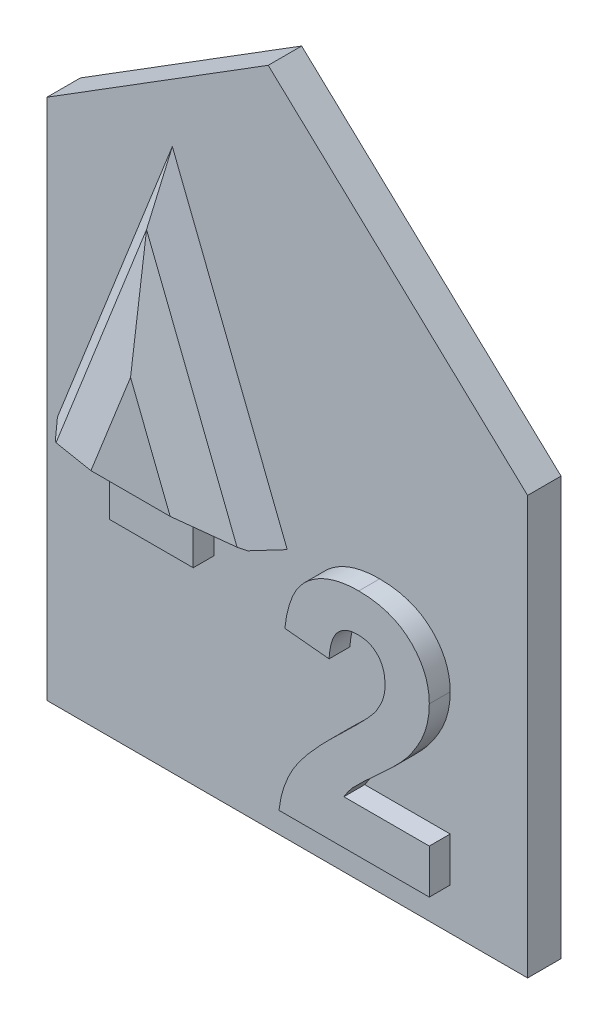
from build123d import *
from OCP.BRepFilletAPI import BRepFilletAPI_MakeChamfer

# Parameters (mm, degrees)
P_IDAT_VYSUNUT_M5_DEPTH = 1.6
P_IDAT_VYSUNUT_M6_DEPTH = 2
SKICA2_7_W              = 2
SKICA2_7_H              = 2
P_IDAT_VYSUNUT_M7_DEPTH = 1
P_IDAT_VYSUNUT_M8_DEPTH = 1
ZKOSEN_5_SIZE2          = 1.678199262
ZKOSEN_5_SIZE           = 2
ZKOSEN_8_SIZE2          = 2
ZKOSEN_8_SIZE           = 1.678199262
ZKOSEN_12_SIZE          = 1.461883237
ZKOSEN_12_SIZE_2        = 1
ZKOSEN_12_SIZE_3        = 0.577350269


with BuildPart() as part:
    # Skica1 → Přidat vysunutím5 (new body)
    with BuildSketch(Plane.XY):
        Polygon((0, 0), (0, 20), (-12.412784718, 31.615626352), (-23, 25), (-23, 0), align=None)
    extrude(amount=P_IDAT_VYSUNUT_M5_DEPTH)

    # Skica2 → Přidat vysunutím6 (add)
    with BuildSketch(Plane.XY.offset(1.6)):
        Polygon((-17, 25.95626352), (-17, 12), (-15, 12), (-11.502481599, 12), align=None)
        Polygon((-22.497518401, 12), (-19, 12), (-17, 12), (-17, 25.95626352), align=None)
    extrude(amount=P_IDAT_VYSUNUT_M6_DEPTH)

    # Skica2<7> → Přidat vysunutím7 (add)
    with BuildSketch(Plane.XY.offset(1.6)):
        with Locations((-16, 11)):
            Rectangle(SKICA2_7_W, SKICA2_7_H)
        with Locations((-18, 11)):
            Rectangle(SKICA2_7_W, SKICA2_7_H)
    extrude(amount=P_IDAT_VYSUNUT_M7_DEPTH)

    # Skica3 → Přidat vysunutím8 (add)
    with BuildSketch(Plane.XY.offset(1.6)):
        with BuildLine():
            Line((-3.705128205, 4.115384615), (-3.705128205, 2))
            Line((-3.705128205, 2), (-10.897435897, 2))
            add(Edge.make_bspline(
                [(-10.897435897, 2), (-10.87308441, 2.180790308), (-10.824395089, 2.542269551), (-10.673865117, 3.070299742), (-10.472959166, 3.585566992), (-10.254913916, 4.004869463), (-10.038043764, 4.342393523), (-9.841277463, 4.618963346), (-9.60654249, 4.913221767), (-9.337245105, 5.227544267), (-9.034873554, 5.562913411), (-8.697171951, 5.918082368), (-8.322529407, 6.291350846), (-8.058961705, 6.54481851), (-7.922676282, 6.67588141)],
                knots=[0, 0, 0, 0, 1.156289446, 2.311930546, 3.473459201, 4.661751613, 5.303057008, 6.018253237, 6.81459331, 7.690699809, 8.644447906, 9.679642995, 10.800191253, 12, 12, 12, 12], degree=3))
            add(Edge.make_bspline(
                [(-7.922676282, 6.67588141), (-7.813918956, 6.780862005), (-7.606877039, 6.980714138), (-7.312048947, 7.266894293), (-7.052864674, 7.529975199), (-6.823905036, 7.763139303), (-6.630459323, 7.972323552), (-6.469982936, 8.154242742), (-6.34044346, 8.309637702), (-6.270284768, 8.408220362), (-6.239182692, 8.451923077)],
                knots=[0, 0, 0, 0, 1.480720495, 2.818855715, 4.024636094, 5.098235712, 6.019786162, 6.815086302, 7.474715479, 8, 8, 8, 8], degree=3))
            add(Edge.make_bspline(
                [(-6.239182692, 8.451923077), (-6.175493233, 8.557718073), (-6.052643645, 8.761784362), (-5.91792888, 9.082682292), (-5.837068057, 9.403513936), (-5.825971765, 9.617891805), (-5.820512821, 9.723357372)],
                knots=[0, 0, 0, 0, 1.0911822, 2.104764037, 3.067617678, 4, 4, 4, 4], degree=3))
            add(Edge.make_bspline(
                [(-5.820512821, 9.723357372), (-5.824474653, 9.833108474), (-5.831970132, 10.040748999), (-5.894821019, 10.333768175), (-6.006276867, 10.585659667), (-6.15973106, 10.797196661), (-6.353774193, 10.962935085), (-6.580616259, 11.085399693), (-6.843577862, 11.153106661), (-7.028402789, 11.16201224), (-7.125, 11.166666667)],
                knots=[0, 0, 0, 0, 1.193122327, 2.257294386, 3.237245624, 4.168877528, 5.075331632, 5.990371598, 6.949684428, 8, 8, 8, 8], degree=3))
            add(Edge.make_bspline(
                [(-7.125, 11.166666667), (-7.220944609, 11.16231978), (-7.406288878, 11.153922533), (-7.669703299, 11.080565334), (-7.900142302, 10.953576306), (-8.06436539, 10.808860058), (-8.175305876, 10.668134018), (-8.250896853, 10.545500545), (-8.316050374, 10.406151312), (-8.37378183, 10.251655158), (-8.419383153, 10.080242168), (-8.456107626, 9.893217825), (-8.485702239, 9.689575671), (-8.495113848, 9.547907653), (-8.5, 9.474358974)],
                knots=[0, 0, 0, 0, 1.402788338, 2.709884207, 3.961032948, 5.225417836, 5.883680772, 6.578928686, 7.329201998, 8.132101139, 8.990263233, 9.922304639, 10.921339128, 12, 12, 12, 12], degree=3))
            Line((-8.5, 9.474358974), (-10.615384615, 9.681490385))
            add(Edge.make_bspline(
                [(-10.615384615, 9.681490385), (-10.598377251, 9.824305509), (-10.565402688, 10.101201217), (-10.483114114, 10.498918926), (-10.378898684, 10.865831465), (-10.247788098, 11.201257911), (-10.095201314, 11.507331251), (-9.913355139, 11.779458664), (-9.708603468, 12.020654551), (-9.480769352, 12.230790543), (-9.231301205, 12.410535137), (-8.969529148, 12.57098477), (-8.690337423, 12.702604473), (-8.396799939, 12.811078884), (-8.089049352, 12.897770766), (-7.765662274, 12.955090263), (-7.42863453, 12.995409017), (-7.198577984, 12.998446608), (-7.080929487, 13)],
                knots=[0, 0, 0, 0, 1.270971563, 2.464210789, 3.586263665, 4.638946707, 5.643716971, 6.603612468, 7.52484387, 8.434700188, 9.336036235, 10.239171475, 11.145359471, 12.059630629, 13.003312604, 13.96741569, 14.960557767, 16, 16, 16, 16], degree=3))
            add(Edge.make_bspline(
                [(-7.080929487, 13), (-6.953030371, 12.997541845), (-6.703930784, 12.992754281), (-6.34028961, 12.953218534), (-5.998674853, 12.884282231), (-5.676099879, 12.79296634), (-5.375877361, 12.67105295), (-5.095505554, 12.52366473), (-4.83939702, 12.345207999), (-4.603734114, 12.145414763), (-4.393070332, 11.925706984), (-4.20854792, 11.691351493), (-4.053955652, 11.442511564), (-3.924228998, 11.182220281), (-3.827907833, 10.90628918), (-3.757724044, 10.618533633), (-3.711189366, 10.317611197), (-3.707170936, 10.112088), (-3.705128205, 10.007612179)],
                knots=[0, 0, 0, 0, 1.210756838, 2.35810096, 3.457354827, 4.507168606, 5.527358126, 6.519769748, 7.499700793, 8.476517721, 9.440526811, 10.376769937, 11.295256217, 12.209626307, 13.124630862, 14.055668209, 15.011616881, 16, 16, 16, 16], degree=3))
            add(Edge.make_bspline(
                [(-3.705128205, 10.007612179), (-3.707819477, 9.887707131), (-3.713158546, 9.649833916), (-3.764276175, 9.298186238), (-3.84237396, 8.954647512), (-3.957796338, 8.618378159), (-4.104103161, 8.28131186), (-4.292696164, 7.942692037), (-4.511666905, 7.592306518), (-4.683112364, 7.36576699), (-4.771634615, 7.248798077)],
                knots=[0, 0, 0, 0, 0.953409949, 1.89141903, 2.821310783, 3.752688675, 4.715703262, 5.740811754, 6.833515735, 8, 8, 8, 8], degree=3))
            add(Edge.make_bspline(
                [(-4.771634615, 7.248798077), (-4.80509214, 7.206658226), (-4.876750403, 7.116404431), (-4.998659939, 6.978014195), (-5.139942605, 6.826848432), (-5.298602846, 6.660077667), (-5.479881522, 6.483607708), (-5.677256214, 6.290058721), (-5.899411985, 6.089331377), (-6.12951153, 5.876418507), (-6.360611244, 5.669193404), (-6.5730252, 5.472375498), (-6.765967752, 5.298233923), (-6.930453202, 5.137155265), (-7.076156545, 5.000133027), (-7.197826149, 4.880140867), (-7.29773874, 4.780083699), (-7.43541186, 4.624119958), (-7.610585282, 4.413178934), (-7.733826947, 4.21161882), (-7.792668269, 4.115384615)],
                knots=[0, 0, 0, 0, 0.665555651, 1.425465941, 2.280616993, 3.225313414, 4.272635571, 5.410053715, 6.644756443, 7.976022804, 9.288331007, 10.484517221, 11.558462543, 12.503158964, 13.33222979, 14.032602617, 14.617328242, 15.080653724, 16.606167857, 18, 18, 18, 18], degree=3))
            Line((-7.792668269, 4.115384615), (-3.705128205, 4.115384615))
        make_face()
    extrude(amount=P_IDAT_VYSUNUT_M8_DEPTH)

    # Zkosení5
    zkosen_5_edges = [part.edges().sort_by_distance(p)[0] for p in [
        (-14.2512408, 18.97813176, 3.6),
    ]]
    zkosen_5_side = [part.faces().sort_by_distance(p)[0] for p in [
        (-14.2512408, 18.97813176, 3.566436015),
    ]]
    chamfer(zkosen_5_edges, length=ZKOSEN_5_SIZE - 0.0001, length2=ZKOSEN_5_SIZE2 - 0.0001, reference=zkosen_5_side[0])  # a hair under: the kernel refuses the full size

    # Zkosení8
    zkosen_8_edges = [part.edges().sort_by_distance(p)[0] for p in [
        (-20.1996587, 17.833456695, 3.6),
    ]]
    zkosen_8_side = [part.faces().sort_by_distance(p)[0] for p in [
        (-20.168430178, 17.821155453, 3.6),
    ]]
    chamfer(zkosen_8_edges, length=ZKOSEN_8_SIZE - 0.0001, length2=ZKOSEN_8_SIZE2 - 0.0001, reference=zkosen_8_side[0])  # a hair under: the kernel refuses the full size

    # Zkosení12
    zkosen_12_edges_1 = [part.edges().sort_by_distance(p)[0] for p in [
        (-15.153039798, 16.68878163, 3.6),
    ]]
    zkosen_12_side_1 = [part.faces().sort_by_distance(p)[0] for p in [
        (-15.171648149, 16.681451605, 3.6),
    ]]
    zkosen_12_edges_2 = [part.edges().sort_by_distance(p)[0] for p in [
        (-17, 12, 3.6),
    ]]
    zkosen_12_side_2 = [part.faces().sort_by_distance(p)[0] for p in [
        (-17, 12, 3.588452995),
    ]]
    zkosen_12_edges_3 = [part.edges().sort_by_distance(p)[0] for p in [
        (-18.846960202, 16.68878163, 3.6),
    ]]
    zkosen_12_side_3 = [part.faces().sort_by_distance(p)[0] for p in [
        (-18.828351851, 16.681451605, 3.6),
    ]]
    zkosen_12 = BRepFilletAPI_MakeChamfer(part.part.solid().wrapped)
    for e in zkosen_12_edges_1:
        zkosen_12.Add(ZKOSEN_12_SIZE - 0.0001, ZKOSEN_12_SIZE_2 - 0.0001, e.wrapped, zkosen_12_side_1[0].wrapped)
    for e in zkosen_12_edges_2:
        zkosen_12.Add(ZKOSEN_12_SIZE_2 - 0.0001, ZKOSEN_12_SIZE_3 - 0.0001, e.wrapped, zkosen_12_side_2[0].wrapped)
    for e in zkosen_12_edges_3:
        zkosen_12.Add(ZKOSEN_12_SIZE - 0.0001, ZKOSEN_12_SIZE_2 - 0.0001, e.wrapped, zkosen_12_side_3[0].wrapped)
    add(Compound.cast(zkosen_12.Shape()), mode=Mode.REPLACE)  # a hair under: the kernel refuses the full size


solid = part.part
